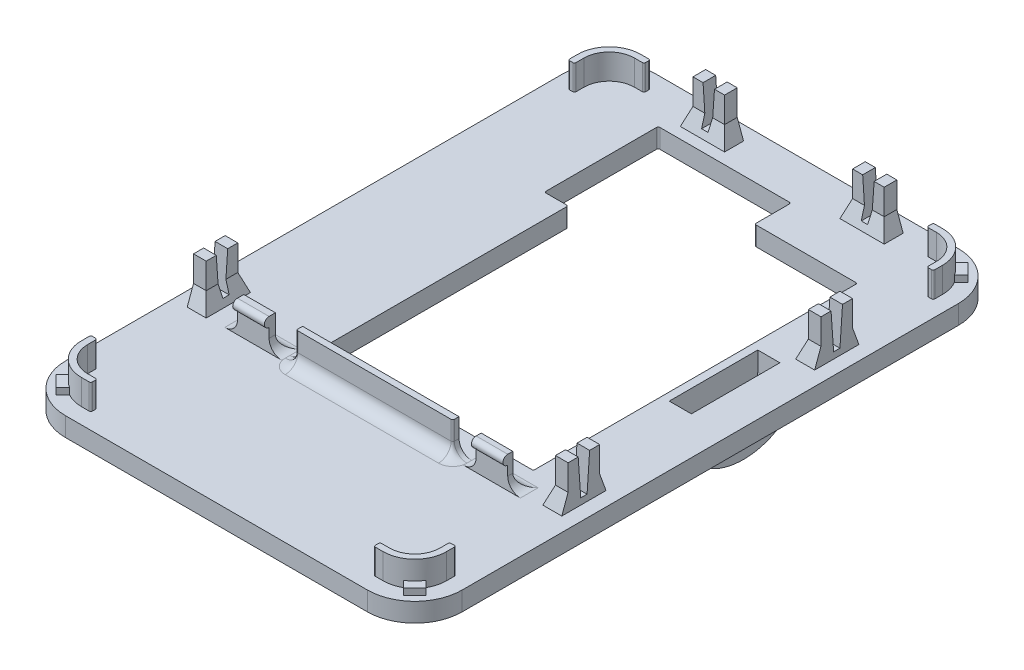
from build123d import *

# Parameters (mm, degrees)
BOSSAGE_BASE_DEPTH                 = 1.5
BOSSAGE_CORNER_DEPTH               = 4
CONGE_CORNER_R                     = 0.25
CONGE_CORNER_OF_SYM_TRIE1_CORNER_R = 0.25
SYM_TRIE2_CORNER_START             = 1
SYM_TRIE2_CORNER_DEPTH             = 4.5
ENL_V_OPENING_DEPTH                = 57.735818713
ENL_V_OPENING_DEPTH_BACK           = 57.735818713
ESQUISSE4_W                        = 3.5
ESQUISSE4_H                        = 14
BALAYAGE_BATTERIE_START            = 21.875
BALAYAGE_BATTERIE_DEPTH            = 3.5
BOSSAGE_BATTERIE_DEPTH             = 1.25
ESQUISSE8_W                        = 5
ESQUISSE8_H                        = 2
ESQUISSE8_W_2                      = 2
ESQUISSE8_H_2                      = 5
BOSSAGE_CLIP_DEPTH                 = 6.8
ENL_V_CLIP_RIGHT_REACH             = 78.907
ENL_V_CLIP_BACK_RIGHT_REACH        = 98.85
ENL_V_CLIP_BACK_LEFT_REACH         = 98.85
ENL_V_CLIP_LEFT1_REACH             = 99.397
ENL_V_CLIP_LEFT2_REACH             = 99.397
CHANFREIN_CLIP_SIZE                = 1
CHANFREIN_CLIP_SIZE_2              = 2.747477419
ESQUISSE15_W                       = 24.75
ESQUISSE15_H                       = 1
ESQUISSE15_W_2                     = 5
ESQUISSE15_H_2                     = 0.798793438
BOSSAGE_PALETTE_DEPTH              = 5
CONG_OPENING_R                     = 0.25
CONG_PALETTE_R                     = 2
BOSSAGE_SPACING_DEPTH              = 2.5
ESQUISSE17_R                       = 0.75
BOSS_EXTRU_1_DEPTH                 = 5
ESQUISSE18_R                       = 0.75
BOSS_EXTRU_2_DEPTH                 = 5


with BuildPart() as part:
    # Esquisse1 → Bossage_base (new, symmetric)
    with BuildSketch(Plane(origin=(0, 0, 0), x_dir=(1, 0, 0), z_dir=(0, 1, 0))):
        with BuildLine():
            Line((-23.875, -46.75), (23.875, -46.75))
            ThreePointArc((23.875, -46.75), (29.178300859, -44.553300859), (31.375, -39.25))
            Line((31.375, -39.25), (31.375, 39.25))
            ThreePointArc((31.375, 39.25), (29.178300859, 44.553300859), (23.875, 46.75))
            Line((23.875, 46.75), (-23.875, 46.75))
            ThreePointArc((-23.875, 46.75), (-29.178300859, 44.553300859), (-31.375, 39.25))
            Line((-31.375, 39.25), (-31.375, -39.25))
            ThreePointArc((-31.375, -39.25), (-29.178300859, -44.553300859), (-23.875, -46.75))
        make_face()
    extrude(amount=BOSSAGE_BASE_DEPTH, both=True)

    # Esquisse3 → Bossage_corner (add)
    with BuildSketch(Plane(origin=(0, 1.5, 0), x_dir=(1, 0, 0), z_dir=(0, 1, 0))):
        with BuildLine():
            Line((-23.875, 44.25), (-22.375, 44.25))
            Line((-22.375, 44.25), (-22.375, 43.25))
            Line((-22.375, 43.25), (-23.875, 43.25))
            ThreePointArc((-23.875, 43.25), (-26.703427125, 42.078427125), (-27.875, 39.25))
            Line((-27.875, 39.25), (-27.875, 37.75))
            Line((-27.875, 37.75), (-28.875, 37.75))
            Line((-28.875, 37.75), (-28.875, 39.25))
            ThreePointArc((-28.875, 39.25), (-27.410533906, 42.785533906), (-23.875, 44.25))
        make_face()
    bossage_corner = extrude(amount=BOSSAGE_CORNER_DEPTH)

    # Conge_corner
    conge_corner_edges = [part.edges().sort_by_distance(p)[0] for p in [
        (-22.375, 3.5, -43.25),
        (-22.375, 3.5, -44.25),
        (-28.875, 3.5, -37.75),
        (-27.875, 3.5, -37.75),
    ]]
    fillet(conge_corner_edges, radius=CONGE_CORNER_R)

    # Symétrie1_corner: Bossage_corner across plane
    add(bossage_corner.mirror(Plane(origin=(0, 0, 0), x_dir=(0, 0, 1), z_dir=(1, 0, 0))))

    # Conge_corner of Symétrie1_corner
    conge_corner_of_sym_trie1_corner_edges = [part.edges().sort_by_distance(p)[0] for p in [
        (22.375, 3.5, -43.25),
        (22.375, 3.5, -44.25),
        (28.875, 3.5, -37.75),
        (27.875, 3.5, -37.75),
    ]]
    fillet(conge_corner_of_sym_trie1_corner_edges, radius=CONGE_CORNER_OF_SYM_TRIE1_CORNER_R)

    # Symétrie2_corner: read off the stored shape, not the designer's step
    # Symétrie2_corner outline → Symétrie2_corner (add)
    with BuildSketch(Plane(origin=(0, 0, 0), x_dir=(1, 0, 0), z_dir=(0, 1, 0)).offset(SYM_TRIE2_CORNER_START)):
        with BuildLine():
            ThreePointArc((-22.625, -44.25), (-22.448223305, -44.176776695), (-22.375, -44))
            Line((-22.375, -44), (-22.375, -43.5))
            ThreePointArc((-22.375, -43.5), (-22.448223305, -43.323223305), (-22.625, -43.25))
            Line((-22.625, -43.25), (-23.875, -43.25))
            ThreePointArc((-23.875, -43.25), (-26.703427125, -42.078427125), (-27.875, -39.25))
            Line((-27.875, -39.25), (-27.875, -38))
            ThreePointArc((-27.875, -38), (-27.948223305, -37.823223305), (-28.125, -37.75))
            Line((-28.125, -37.75), (-28.625, -37.75))
            ThreePointArc((-28.625, -37.75), (-28.801776695, -37.823223305), (-28.875, -38))
            Line((-28.875, -38), (-28.875, -39.25))
            ThreePointArc((-28.875, -39.25), (-27.410533906, -42.785533906), (-23.875, -44.25))
            Line((-23.875, -44.25), (-22.625, -44.25))
        make_face()
        with BuildLine():
            Line((27.875, -38), (27.875, -39.25))
            ThreePointArc((27.875, -39.25), (26.703427125, -42.078427125), (23.875, -43.25))
            Line((23.875, -43.25), (22.625, -43.25))
            ThreePointArc((22.625, -43.25), (22.448223305, -43.323223305), (22.375, -43.5))
            Line((22.375, -43.5), (22.375, -44))
            ThreePointArc((22.375, -44), (22.448223305, -44.176776695), (22.625, -44.25))
            Line((22.625, -44.25), (23.875, -44.25))
            ThreePointArc((23.875, -44.25), (27.410533906, -42.785533906), (28.875, -39.25))
            Line((28.875, -39.25), (28.875, -38))
            ThreePointArc((28.875, -38), (28.801776695, -37.823223305), (28.625, -37.75))
            Line((28.625, -37.75), (28.125, -37.75))
            ThreePointArc((28.125, -37.75), (27.948223305, -37.823223305), (27.875, -38))
        make_face()
    extrude(amount=SYM_TRIE2_CORNER_DEPTH)

    # Esquisse4 → Enlèv_opening (cut, two sides: drawn at the far end of the back side and taken through both)
    with BuildSketch(Plane(origin=(0, -1.5, 0), x_dir=(-1, 0, 0), z_dir=(0, -1, 0)).offset(-ENL_V_OPENING_DEPTH_BACK)):
        Polygon((-20.625, 34), (-4.375, 34), (-4.375, 39.75), (16.625, 39.75), (16.625, 21.75), (12.875, 21.75), (12.875, -20.5), (-3.625, -20.5), (-3.625, -17.25), (-20.625, -17.25), align=None)
        with Locations((-23.625, 10)):
            Rectangle(ESQUISSE4_W, ESQUISSE4_H)
    extrude(amount=ENL_V_OPENING_DEPTH + ENL_V_OPENING_DEPTH_BACK, mode=Mode.SUBTRACT)

    # Balayage_batterie: read off the stored shape, not the designer's step
    # Balayage_batterie outline → Balayage_batterie (add)
    with BuildSketch(Plane.YZ.offset(BALAYAGE_BATTERIE_START)):
        with BuildLine():
            Line((-1.5, -3), (-1.5, -1.75))
            add(Edge.make_bspline(
                [(-1.5, -1.75), (-3.190722232, -1.750000002), (-4.786990528, -2.705218815), (-7.00497116, -5.780146506), (-7.625, -7.885757532), (-7.625, -12.114242468), (-7.00497116, -14.219853494), (-4.786990528, -17.294781185), (-3.190722232, -18.249999998), (-1.5, -18.25)],
                knots=[0, 0, 0, 0, 0.25, 0.25, 0.5, 0.5, 0.75, 0.75, 1, 1, 1, 1], degree=3))
            Line((-1.5, -18.25), (-1.5, -17))
            add(Edge.make_bspline(
                [(-1.5, -3), (-2.708159254, -3.000000002), (-3.954865391, -3.68832461), (-5.809522107, -6.259553243), (-6.375, -8.121805918), (-6.375, -11.878194082), (-5.809522107, -13.740446757), (-3.954865391, -16.31167539), (-2.708159254, -16.999999998), (-1.5, -17)],
                knots=[0, 0, 0, 0, 0.25, 0.25, 0.5, 0.5, 0.75, 0.75, 1, 1, 1, 1], degree=3))
        make_face()
    extrude(amount=BALAYAGE_BATTERIE_DEPTH)

    # Esquisse7 → Bossage_batterie (add)
    with BuildSketch(Plane(origin=(25.375, 0, 0), x_dir=(0, 0, -1), z_dir=(1, 0, 0))):
        with BuildLine():
            Line((1.75, -1.5), (18.25, -1.5))
            add(Edge.make_bspline(
                [(1.75, -1.5), (1.750000002, -3.190722232), (2.705218815, -4.786990528), (5.780146506, -7.00497116), (7.885757532, -7.625), (12.114242468, -7.625), (14.219853494, -7.00497116), (17.294781185, -4.786990528), (18.249999998, -3.190722232), (18.25, -1.5)],
                knots=[0, 0, 0, 0, 0.25, 0.25, 0.5, 0.5, 0.75, 0.75, 1, 1, 1, 1], degree=3))
        make_face()
    bossage_batterie = extrude(amount=BOSSAGE_BATTERIE_DEPTH)

    # Symétrie_batterie: Bossage_batterie across plane
    add(bossage_batterie.mirror(Plane.ZY.offset(-23.625)))

    # Esquisse8 → Bossage_clip (add)
    with BuildSketch(Plane(origin=(0, 1.5, 0), x_dir=(1, 0, 0), z_dir=(0, 1, 0))):
        with Locations((13.875, 43.5)):
            Rectangle(ESQUISSE8_W, ESQUISSE8_H)
        with Locations((-11.375, 43.5)):
            Rectangle(ESQUISSE8_W, ESQUISSE8_H)
        with Locations((-28.125, -18.75)):
            Rectangle(ESQUISSE8_W_2, ESQUISSE8_H_2)
        with Locations((28.125, 22.25)):
            Rectangle(ESQUISSE8_W_2, ESQUISSE8_H_2)
        with Locations((28.125, -17.75)):
            Rectangle(ESQUISSE8_W_2, ESQUISSE8_H_2)
    extrude(amount=BOSSAGE_CLIP_DEPTH)

    # Esquisse9 → Enlèv_clip_right (cut, up to next)
    with BuildSketch(Plane.ZY.offset(29.125), mode=Mode.PRIVATE) as enl_v_clip_right_sk1:
        Polygon((19.655575509, 8.3), (17.844424491, 8.3), (18.25, 2.5), (19.25, 2.5), align=None)
    enl_v_clip_right_tool1 = extrude(enl_v_clip_right_sk1.sketch, amount=-ENL_V_CLIP_RIGHT_REACH, mode=Mode.PRIVATE) & part.part
    add(enl_v_clip_right_tool1.solids().sort_by_distance((-29.125, 5.678929, 18.75))[0], mode=Mode.SUBTRACT)

    # Esquisse10 → Enlèv_clip_back_right (cut, up to next)
    with BuildSketch(Plane.XY.offset(-44.5), mode=Mode.PRIVATE) as enl_v_clip_back_right_sk1:
        Polygon((-10.469424491, 8.3), (-12.280575509, 8.3), (-11.875, 2.5), (-10.875, 2.5), align=None)
    enl_v_clip_back_right_tool1 = extrude(enl_v_clip_back_right_sk1.sketch, amount=ENL_V_CLIP_BACK_RIGHT_REACH, mode=Mode.PRIVATE) & part.part
    add(enl_v_clip_back_right_tool1.solids().sort_by_distance((-11.375, 5.678929, -44.5))[0], mode=Mode.SUBTRACT)

    # Esquisse11 → Enlèv_clip_back_left (cut, up to next)
    with BuildSketch(Plane.XY.offset(-44.5), mode=Mode.PRIVATE) as enl_v_clip_back_left_sk1:
        Polygon((14.780575509, 8.3), (12.969424491, 8.3), (13.375, 2.5), (14.375, 2.5), align=None)
    enl_v_clip_back_left_tool1 = extrude(enl_v_clip_back_left_sk1.sketch, amount=ENL_V_CLIP_BACK_LEFT_REACH, mode=Mode.PRIVATE) & part.part
    add(enl_v_clip_back_left_tool1.solids().sort_by_distance((13.875, 5.678929, -44.5))[0], mode=Mode.SUBTRACT)

    # Esquisse12 → Enlèv_clip_left1 (cut, up to next)
    with BuildSketch(Plane(origin=(29.125, 0, -29.125), x_dir=(0, 0, 1), z_dir=(-1, 0, 0)), mode=Mode.PRIVATE) as enl_v_clip_left1_sk1:
        Polygon((7.780575509, 8.3), (5.969424491, 8.3), (6.375, 2.5), (7.375, 2.5), align=None)
    enl_v_clip_left1_tool1 = extrude(enl_v_clip_left1_sk1.sketch, amount=ENL_V_CLIP_LEFT1_REACH, mode=Mode.PRIVATE) & part.part
    add(enl_v_clip_left1_tool1.solids().sort_by_distance((29.125, 5.678929, -22.25))[0], mode=Mode.SUBTRACT)

    # Esquisse13 → Enlèv_clip_left2 (cut, up to next)
    with BuildSketch(Plane(origin=(29.125, 0, -29.125), x_dir=(0, 0, 1), z_dir=(-1, 0, 0)), mode=Mode.PRIVATE) as enl_v_clip_left2_sk1:
        Polygon((47.780575509, 8.3), (45.969424491, 8.3), (46.375, 2.5), (47.375, 2.5), align=None)
    enl_v_clip_left2_tool1 = extrude(enl_v_clip_left2_sk1.sketch, amount=ENL_V_CLIP_LEFT2_REACH, mode=Mode.PRIVATE) & part.part
    add(enl_v_clip_left2_tool1.solids().sort_by_distance((29.125, 5.678929, 17.75))[0], mode=Mode.SUBTRACT)

    # Chanfrein_clip
    # the kernel refuses this chamfer: 2.747477419, 1 mm, written as the material it adds along each edge
    with BuildSketch(Plane(origin=(-19.997508551, 1.5, 21.25), x_dir=(0, 0, 1), z_dir=(-1, 0, 0))) as chanfrein_clip_piece_1_section:
        Polygon((CHANFREIN_CLIP_SIZE, 0), (0, CHANFREIN_CLIP_SIZE_2), (0, 0), align=None)
    chanfrein_clip_piece_1 = extrude(amount=9.127491449, mode=Mode.PRIVATE)
    chanfrein_clip_piece_1 = split(chanfrein_clip_piece_1, bisect_by=Plane(origin=(-25.408219663, -0.469337791, 21.25), z_dir=(-0.9396926207859094, -0.34202014332566605, 0)), keep=Keep.TOP, mode=Mode.PRIVATE)
    add(chanfrein_clip_piece_1)
    with BuildSketch(Plane(origin=(-27.125, 1.5, 9.122508551), x_dir=(1, 0, 0), z_dir=(0, 0, 1))) as chanfrein_clip_piece_2_section:
        Polygon((CHANFREIN_CLIP_SIZE, 0), (0, CHANFREIN_CLIP_SIZE_2), (0, 0), align=None)
    chanfrein_clip_piece_2 = extrude(amount=19.254982899, mode=Mode.PRIVATE)
    chanfrein_clip_piece_2 = split(chanfrein_clip_piece_2, bisect_by=Plane(origin=(-27.125, 2.5, 9.122508551), z_dir=(0, -1, 0)), keep=Keep.TOP, mode=Mode.PRIVATE)
    chanfrein_clip_piece_2 = split(chanfrein_clip_piece_2, bisect_by=Plane(origin=(-27.125, 5.719094425, 20.714375214), z_dir=(0, -0.34202014332566605, -0.9396926207859094)), keep=Keep.TOP, mode=Mode.PRIVATE)
    chanfrein_clip_piece_2 = split(chanfrein_clip_piece_2, bisect_by=Plane(origin=(-27.125, -0.469337791, 14.533219663), z_dir=(0, -0.34202014332566605, 0.9396926207859094)), keep=Keep.TOP, mode=Mode.PRIVATE)
    add(chanfrein_clip_piece_2)
    with BuildSketch(Plane(origin=(-27.125, 1.5, 9.122508551), x_dir=(1, 0, 0), z_dir=(0, 0, 1))) as chanfrein_clip_piece_3_section:
        Polygon((CHANFREIN_CLIP_SIZE, 0), (0, CHANFREIN_CLIP_SIZE_2), (0, 0), align=None)
    chanfrein_clip_piece_3 = extrude(amount=19.254982899, mode=Mode.PRIVATE)
    chanfrein_clip_piece_3 = split(chanfrein_clip_piece_3, bisect_by=Plane(origin=(-27.125, 2.14001661, 18.275172491), z_dir=(0, -0.06975647374412401, -0.9975640502598243)), keep=Keep.TOP, mode=Mode.PRIVATE)
    chanfrein_clip_piece_3 = split(chanfrein_clip_piece_3, bisect_by=Plane(origin=(-27.125, -0.469337791, 14.533219663), z_dir=(0, -0.34202014332566605, 0.9396926207859094)), keep=Keep.TOP, mode=Mode.PRIVATE)
    add(chanfrein_clip_piece_3)
    with BuildSketch(Plane(origin=(-27.125, 1.5, 9.122508551), x_dir=(1, 0, 0), z_dir=(0, 0, 1))) as chanfrein_clip_piece_4_section:
        Polygon((CHANFREIN_CLIP_SIZE, 0), (0, CHANFREIN_CLIP_SIZE_2), (0, 0), align=None)
    chanfrein_clip_piece_4 = extrude(amount=19.254982899, mode=Mode.PRIVATE)
    chanfrein_clip_piece_4 = split(chanfrein_clip_piece_4, bisect_by=Plane(origin=(-27.125, 0.800128771, 19.131133424), z_dir=(0, -0.0697564737441234, 0.9975640502598244)), keep=Keep.TOP, mode=Mode.PRIVATE)
    chanfrein_clip_piece_4 = split(chanfrein_clip_piece_4, bisect_by=Plane(origin=(-27.125, 5.719094425, 20.714375214), z_dir=(0, -0.34202014332566605, -0.9396926207859094)), keep=Keep.TOP, mode=Mode.PRIVATE)
    add(chanfrein_clip_piece_4)
    with BuildSketch(Plane(origin=(-29.125, 1.5, 16.25), x_dir=(0, 0, -1), z_dir=(1, 0, 0))) as chanfrein_clip_piece_5_section:
        Polygon((CHANFREIN_CLIP_SIZE, 0), (0, CHANFREIN_CLIP_SIZE_2), (0, 0), align=None)
    chanfrein_clip_piece_5 = extrude(amount=9.127491449, mode=Mode.PRIVATE)
    chanfrein_clip_piece_5 = split(chanfrein_clip_piece_5, bisect_by=Plane(origin=(-26.475933335, 2.464181415, 16.25), z_dir=(-0.9396926207859094, -0.34202014332566605, 0)), keep=Keep.TOP, mode=Mode.PRIVATE)
    add(chanfrein_clip_piece_5)
    with BuildSketch(Plane(origin=(-13.875, 1.5, -35.372508551), x_dir=(-1, 0, 0), z_dir=(0, 0, -1))) as chanfrein_clip_piece_6_section:
        Polygon((CHANFREIN_CLIP_SIZE, 0), (0, CHANFREIN_CLIP_SIZE_2), (0, 0), align=None)
    chanfrein_clip_piece_6 = extrude(amount=9.127491449, mode=Mode.PRIVATE)
    chanfrein_clip_piece_6 = split(chanfrein_clip_piece_6, bisect_by=Plane(origin=(-13.875, -0.469337791, -40.783219663), z_dir=(0, -0.34202014332566605, -0.9396926207859094)), keep=Keep.TOP, mode=Mode.PRIVATE)
    add(chanfrein_clip_piece_6)
    with BuildSketch(Plane(origin=(-1.747508551, 1.5, -42.5), x_dir=(0, 0, 1), z_dir=(-1, 0, 0))) as chanfrein_clip_piece_7_section:
        Polygon((CHANFREIN_CLIP_SIZE, 0), (0, CHANFREIN_CLIP_SIZE_2), (0, 0), align=None)
    chanfrein_clip_piece_7 = extrude(amount=19.254982899, mode=Mode.PRIVATE)
    chanfrein_clip_piece_7 = split(chanfrein_clip_piece_7, bisect_by=Plane(origin=(-1.747508551, 2.5, -42.5), z_dir=(0, -1, 0)), keep=Keep.TOP, mode=Mode.PRIVATE)
    chanfrein_clip_piece_7 = split(chanfrein_clip_piece_7, bisect_by=Plane(origin=(-13.339375214, 5.719094425, -42.5), z_dir=(0.9396926207859094, -0.34202014332566605, 1.6692294138669905e-15)), keep=Keep.TOP, mode=Mode.PRIVATE)
    chanfrein_clip_piece_7 = split(chanfrein_clip_piece_7, bisect_by=Plane(origin=(-7.158219663, -0.469337791, -42.5), z_dir=(-0.9396926207859094, -0.34202014332566605, 1.6692294138669905e-15)), keep=Keep.TOP, mode=Mode.PRIVATE)
    add(chanfrein_clip_piece_7)
    with BuildSketch(Plane(origin=(-1.747508551, 1.5, -42.5), x_dir=(0, 0, 1), z_dir=(-1, 0, 0))) as chanfrein_clip_piece_8_section:
        Polygon((CHANFREIN_CLIP_SIZE, 0), (0, CHANFREIN_CLIP_SIZE_2), (0, 0), align=None)
    chanfrein_clip_piece_8 = extrude(amount=19.254982899, mode=Mode.PRIVATE)
    chanfrein_clip_piece_8 = split(chanfrein_clip_piece_8, bisect_by=Plane(origin=(-10.900172491, 2.14001661, -42.5), z_dir=(0.9975640502598243, -0.06975647374412587, 0)), keep=Keep.TOP, mode=Mode.PRIVATE)
    chanfrein_clip_piece_8 = split(chanfrein_clip_piece_8, bisect_by=Plane(origin=(-7.158219663, -0.469337791, -42.5), z_dir=(-0.9396926207859094, -0.34202014332566605, 1.6692294138669905e-15)), keep=Keep.TOP, mode=Mode.PRIVATE)
    add(chanfrein_clip_piece_8)
    with BuildSketch(Plane(origin=(-1.747508551, 1.5, -42.5), x_dir=(0, 0, 1), z_dir=(-1, 0, 0))) as chanfrein_clip_piece_9_section:
        Polygon((CHANFREIN_CLIP_SIZE, 0), (0, CHANFREIN_CLIP_SIZE_2), (0, 0), align=None)
    chanfrein_clip_piece_9 = extrude(amount=19.254982899, mode=Mode.PRIVATE)
    chanfrein_clip_piece_9 = split(chanfrein_clip_piece_9, bisect_by=Plane(origin=(-11.756133424, 0.800128771, -42.5), z_dir=(-0.9975640502598243, -0.06975647374412587, 0)), keep=Keep.TOP, mode=Mode.PRIVATE)
    chanfrein_clip_piece_9 = split(chanfrein_clip_piece_9, bisect_by=Plane(origin=(-13.339375214, 5.719094425, -42.5), z_dir=(0.9396926207859094, -0.34202014332566605, 1.6692294138669905e-15)), keep=Keep.TOP, mode=Mode.PRIVATE)
    add(chanfrein_clip_piece_9)
    with BuildSketch(Plane(origin=(-8.875, 1.5, -44.5), x_dir=(1, 0, 0), z_dir=(0, 0, 1))) as chanfrein_clip_piece_10_section:
        Polygon((CHANFREIN_CLIP_SIZE, 0), (0, CHANFREIN_CLIP_SIZE_2), (0, 0), align=None)
    chanfrein_clip_piece_10 = extrude(amount=9.127491449, mode=Mode.PRIVATE)
    chanfrein_clip_piece_10 = split(chanfrein_clip_piece_10, bisect_by=Plane(origin=(-8.875, 2.464181415, -41.850933335), z_dir=(0, -0.34202014332566605, -0.9396926207859094)), keep=Keep.TOP, mode=Mode.PRIVATE)
    add(chanfrein_clip_piece_10)
    with BuildSketch(Plane(origin=(11.375, 1.5, -35.372508551), x_dir=(-1, 0, 0), z_dir=(0, 0, -1))) as chanfrein_clip_piece_11_section:
        Polygon((CHANFREIN_CLIP_SIZE, 0), (0, CHANFREIN_CLIP_SIZE_2), (0, 0), align=None)
    chanfrein_clip_piece_11 = extrude(amount=9.127491449, mode=Mode.PRIVATE)
    chanfrein_clip_piece_11 = split(chanfrein_clip_piece_11, bisect_by=Plane(origin=(11.375, -0.469337791, -40.783219663), z_dir=(0, -0.34202014332566605, -0.9396926207859094)), keep=Keep.TOP, mode=Mode.PRIVATE)
    add(chanfrein_clip_piece_11)
    with BuildSketch(Plane(origin=(23.502491449, 1.5, -42.5), x_dir=(0, 0, 1), z_dir=(-1, 0, 0))) as chanfrein_clip_piece_12_section:
        Polygon((CHANFREIN_CLIP_SIZE, 0), (0, CHANFREIN_CLIP_SIZE_2), (0, 0), align=None)
    chanfrein_clip_piece_12 = extrude(amount=19.254982899, mode=Mode.PRIVATE)
    chanfrein_clip_piece_12 = split(chanfrein_clip_piece_12, bisect_by=Plane(origin=(23.502491449, 2.5, -42.5), z_dir=(0, -1, 0)), keep=Keep.TOP, mode=Mode.PRIVATE)
    chanfrein_clip_piece_12 = split(chanfrein_clip_piece_12, bisect_by=Plane(origin=(11.910624786, 5.719094425, -42.5), z_dir=(0.9396926207859094, -0.34202014332566605, 0)), keep=Keep.TOP, mode=Mode.PRIVATE)
    chanfrein_clip_piece_12 = split(chanfrein_clip_piece_12, bisect_by=Plane(origin=(18.091780337, -0.469337791, -42.5), z_dir=(-0.939692620785909, -0.3420201433256671, -1.6692294138669895e-15)), keep=Keep.TOP, mode=Mode.PRIVATE)
    add(chanfrein_clip_piece_12)
    with BuildSketch(Plane(origin=(23.502491449, 1.5, -42.5), x_dir=(0, 0, 1), z_dir=(-1, 0, 0))) as chanfrein_clip_piece_13_section:
        Polygon((CHANFREIN_CLIP_SIZE, 0), (0, CHANFREIN_CLIP_SIZE_2), (0, 0), align=None)
    chanfrein_clip_piece_13 = extrude(amount=19.254982899, mode=Mode.PRIVATE)
    chanfrein_clip_piece_13 = split(chanfrein_clip_piece_13, bisect_by=Plane(origin=(14.349827509, 2.14001661, -42.5), z_dir=(0.9975640502598243, -0.06975647374412525, 0)), keep=Keep.TOP, mode=Mode.PRIVATE)
    chanfrein_clip_piece_13 = split(chanfrein_clip_piece_13, bisect_by=Plane(origin=(18.091780337, -0.469337791, -42.5), z_dir=(-0.939692620785909, -0.3420201433256671, -1.6692294138669895e-15)), keep=Keep.TOP, mode=Mode.PRIVATE)
    add(chanfrein_clip_piece_13)
    with BuildSketch(Plane(origin=(23.502491449, 1.5, -42.5), x_dir=(0, 0, 1), z_dir=(-1, 0, 0))) as chanfrein_clip_piece_14_section:
        Polygon((CHANFREIN_CLIP_SIZE, 0), (0, CHANFREIN_CLIP_SIZE_2), (0, 0), align=None)
    chanfrein_clip_piece_14 = extrude(amount=19.254982899, mode=Mode.PRIVATE)
    chanfrein_clip_piece_14 = split(chanfrein_clip_piece_14, bisect_by=Plane(origin=(13.493866576, 0.800128771, -42.5), z_dir=(-0.9975640502598243, -0.06975647374412555, 0)), keep=Keep.TOP, mode=Mode.PRIVATE)
    chanfrein_clip_piece_14 = split(chanfrein_clip_piece_14, bisect_by=Plane(origin=(11.910624786, 5.719094425, -42.5), z_dir=(0.9396926207859094, -0.34202014332566605, 0)), keep=Keep.TOP, mode=Mode.PRIVATE)
    add(chanfrein_clip_piece_14)
    with BuildSketch(Plane(origin=(16.375, 1.5, -44.5), x_dir=(1, 0, 0), z_dir=(0, 0, 1))) as chanfrein_clip_piece_15_section:
        Polygon((CHANFREIN_CLIP_SIZE, 0), (0, CHANFREIN_CLIP_SIZE_2), (0, 0), align=None)
    chanfrein_clip_piece_15 = extrude(amount=9.127491449, mode=Mode.PRIVATE)
    chanfrein_clip_piece_15 = split(chanfrein_clip_piece_15, bisect_by=Plane(origin=(16.375, 2.464181415, -41.850933335), z_dir=(0, -0.34202014332566605, -0.9396926207859094)), keep=Keep.TOP, mode=Mode.PRIVATE)
    add(chanfrein_clip_piece_15)
    with BuildSketch(Plane(origin=(29.125, 1.5, -24.75), x_dir=(0, 0, -1), z_dir=(-1, 0, 0))) as chanfrein_clip_piece_16_section:
        Polygon((CHANFREIN_CLIP_SIZE, 0), (0, -CHANFREIN_CLIP_SIZE_2), (0, 0), align=None)
    chanfrein_clip_piece_16 = extrude(amount=9.127491449, mode=Mode.PRIVATE)
    chanfrein_clip_piece_16 = split(chanfrein_clip_piece_16, bisect_by=Plane(origin=(26.475933335, 2.464181415, -24.75), z_dir=(0.9396926207859094, -0.34202014332566605, 0)), keep=Keep.TOP, mode=Mode.PRIVATE)
    add(chanfrein_clip_piece_16)
    with BuildSketch(Plane(origin=(27.125, 1.5, -31.877491449), x_dir=(-1, 0, 0), z_dir=(0, 0, 1))) as chanfrein_clip_piece_17_section:
        Polygon((CHANFREIN_CLIP_SIZE, 0), (0, -CHANFREIN_CLIP_SIZE_2), (0, 0), align=None)
    chanfrein_clip_piece_17 = extrude(amount=19.254982899, mode=Mode.PRIVATE)
    chanfrein_clip_piece_17 = split(chanfrein_clip_piece_17, bisect_by=Plane(origin=(27.125, 2.5, -31.877491449), z_dir=(0, -1, 0)), keep=Keep.TOP, mode=Mode.PRIVATE)
    chanfrein_clip_piece_17 = split(chanfrein_clip_piece_17, bisect_by=Plane(origin=(27.125, 5.719094425, -20.285624786), z_dir=(-1.6692294138669964e-15, -0.34202014332566605, -0.9396926207859094)), keep=Keep.TOP, mode=Mode.PRIVATE)
    chanfrein_clip_piece_17 = split(chanfrein_clip_piece_17, bisect_by=Plane(origin=(27.125, -0.469337791, -26.466780337), z_dir=(-1.6692294138669964e-15, -0.34202014332566605, 0.9396926207859094)), keep=Keep.TOP, mode=Mode.PRIVATE)
    add(chanfrein_clip_piece_17)
    with BuildSketch(Plane(origin=(27.125, 1.5, -31.877491449), x_dir=(-1, 0, 0), z_dir=(0, 0, 1))) as chanfrein_clip_piece_18_section:
        Polygon((CHANFREIN_CLIP_SIZE, 0), (0, -CHANFREIN_CLIP_SIZE_2), (0, 0), align=None)
    chanfrein_clip_piece_18 = extrude(amount=19.254982899, mode=Mode.PRIVATE)
    chanfrein_clip_piece_18 = split(chanfrein_clip_piece_18, bisect_by=Plane(origin=(27.125, 2.14001661, -22.724827509), z_dir=(0, -0.06975647374412568, -0.9975640502598243)), keep=Keep.TOP, mode=Mode.PRIVATE)
    chanfrein_clip_piece_18 = split(chanfrein_clip_piece_18, bisect_by=Plane(origin=(27.125, -0.469337791, -26.466780337), z_dir=(-1.6692294138669964e-15, -0.34202014332566605, 0.9396926207859094)), keep=Keep.TOP, mode=Mode.PRIVATE)
    add(chanfrein_clip_piece_18)
    with BuildSketch(Plane(origin=(27.125, 1.5, -31.877491449), x_dir=(-1, 0, 0), z_dir=(0, 0, 1))) as chanfrein_clip_piece_19_section:
        Polygon((CHANFREIN_CLIP_SIZE, 0), (0, -CHANFREIN_CLIP_SIZE_2), (0, 0), align=None)
    chanfrein_clip_piece_19 = extrude(amount=19.254982899, mode=Mode.PRIVATE)
    chanfrein_clip_piece_19 = split(chanfrein_clip_piece_19, bisect_by=Plane(origin=(27.125, 0.800128771, -21.868866576), z_dir=(0, -0.06975647374412583, 0.9975640502598243)), keep=Keep.TOP, mode=Mode.PRIVATE)
    chanfrein_clip_piece_19 = split(chanfrein_clip_piece_19, bisect_by=Plane(origin=(27.125, 5.719094425, -20.285624786), z_dir=(-1.6692294138669964e-15, -0.34202014332566605, -0.9396926207859094)), keep=Keep.TOP, mode=Mode.PRIVATE)
    add(chanfrein_clip_piece_19)
    with BuildSketch(Plane(origin=(19.997508551, 1.5, -19.75), x_dir=(0, 0, 1), z_dir=(1, 0, 0))) as chanfrein_clip_piece_20_section:
        Polygon((CHANFREIN_CLIP_SIZE, 0), (0, -CHANFREIN_CLIP_SIZE_2), (0, 0), align=None)
    chanfrein_clip_piece_20 = extrude(amount=9.127491449, mode=Mode.PRIVATE)
    chanfrein_clip_piece_20 = split(chanfrein_clip_piece_20, bisect_by=Plane(origin=(25.408219663, -0.469337791, -19.75), z_dir=(0.9396926207859094, -0.34202014332566605, 0)), keep=Keep.TOP, mode=Mode.PRIVATE)
    add(chanfrein_clip_piece_20)
    with BuildSketch(Plane(origin=(29.125, 1.5, 15.25), x_dir=(0, 0, -1), z_dir=(-1, 0, 0))) as chanfrein_clip_piece_21_section:
        Polygon((CHANFREIN_CLIP_SIZE, 0), (0, -CHANFREIN_CLIP_SIZE_2), (0, 0), align=None)
    chanfrein_clip_piece_21 = extrude(amount=9.127491449, mode=Mode.PRIVATE)
    chanfrein_clip_piece_21 = split(chanfrein_clip_piece_21, bisect_by=Plane(origin=(26.475933335, 2.464181415, 15.25), z_dir=(0.9396926207859094, -0.34202014332566605, 0)), keep=Keep.TOP, mode=Mode.PRIVATE)
    add(chanfrein_clip_piece_21)
    with BuildSketch(Plane(origin=(27.125, 1.5, 8.122508551), x_dir=(-1, 0, 0), z_dir=(0, 0, 1))) as chanfrein_clip_piece_22_section:
        Polygon((CHANFREIN_CLIP_SIZE, 0), (0, -CHANFREIN_CLIP_SIZE_2), (0, 0), align=None)
    chanfrein_clip_piece_22 = extrude(amount=19.254982899, mode=Mode.PRIVATE)
    chanfrein_clip_piece_22 = split(chanfrein_clip_piece_22, bisect_by=Plane(origin=(27.125, 2.5, 8.122508551), z_dir=(0, -1, 0)), keep=Keep.TOP, mode=Mode.PRIVATE)
    chanfrein_clip_piece_22 = split(chanfrein_clip_piece_22, bisect_by=Plane(origin=(27.125, -0.469337791, 13.533219663), z_dir=(0, -0.34202014332566605, 0.9396926207859094)), keep=Keep.TOP, mode=Mode.PRIVATE)
    chanfrein_clip_piece_22 = split(chanfrein_clip_piece_22, bisect_by=Plane(origin=(27.125, 5.719094425, 19.714375214), z_dir=(0, -0.34202014332566605, -0.9396926207859094)), keep=Keep.TOP, mode=Mode.PRIVATE)
    add(chanfrein_clip_piece_22)
    with BuildSketch(Plane(origin=(27.125, 1.5, 8.122508551), x_dir=(-1, 0, 0), z_dir=(0, 0, 1))) as chanfrein_clip_piece_23_section:
        Polygon((CHANFREIN_CLIP_SIZE, 0), (0, -CHANFREIN_CLIP_SIZE_2), (0, 0), align=None)
    chanfrein_clip_piece_23 = extrude(amount=19.254982899, mode=Mode.PRIVATE)
    chanfrein_clip_piece_23 = split(chanfrein_clip_piece_23, bisect_by=Plane(origin=(27.125, 2.14001661, 17.275172491), z_dir=(0, -0.06975647374412647, -0.9975640502598242)), keep=Keep.TOP, mode=Mode.PRIVATE)
    chanfrein_clip_piece_23 = split(chanfrein_clip_piece_23, bisect_by=Plane(origin=(27.125, -0.469337791, 13.533219663), z_dir=(0, -0.34202014332566605, 0.9396926207859094)), keep=Keep.TOP, mode=Mode.PRIVATE)
    add(chanfrein_clip_piece_23)
    with BuildSketch(Plane(origin=(27.125, 1.5, 8.122508551), x_dir=(-1, 0, 0), z_dir=(0, 0, 1))) as chanfrein_clip_piece_24_section:
        Polygon((CHANFREIN_CLIP_SIZE, 0), (0, -CHANFREIN_CLIP_SIZE_2), (0, 0), align=None)
    chanfrein_clip_piece_24 = extrude(amount=19.254982899, mode=Mode.PRIVATE)
    chanfrein_clip_piece_24 = split(chanfrein_clip_piece_24, bisect_by=Plane(origin=(27.125, 0.800128771, 18.131133424), z_dir=(0, -0.0697564737441265, 0.9975640502598242)), keep=Keep.TOP, mode=Mode.PRIVATE)
    chanfrein_clip_piece_24 = split(chanfrein_clip_piece_24, bisect_by=Plane(origin=(27.125, 5.719094425, 19.714375214), z_dir=(0, -0.34202014332566605, -0.9396926207859094)), keep=Keep.TOP, mode=Mode.PRIVATE)
    add(chanfrein_clip_piece_24)
    with BuildSketch(Plane(origin=(19.997508551, 1.5, 20.25), x_dir=(0, 0, 1), z_dir=(1, 0, 0))) as chanfrein_clip_piece_25_section:
        Polygon((CHANFREIN_CLIP_SIZE, 0), (0, -CHANFREIN_CLIP_SIZE_2), (0, 0), align=None)
    chanfrein_clip_piece_25 = extrude(amount=9.127491449, mode=Mode.PRIVATE)
    chanfrein_clip_piece_25 = split(chanfrein_clip_piece_25, bisect_by=Plane(origin=(25.408219663, -0.469337791, 20.25), z_dir=(0.9396926207859094, -0.34202014332566605, 0)), keep=Keep.TOP, mode=Mode.PRIVATE)
    add(chanfrein_clip_piece_25)

    # Esquisse15 → Bossage_palette (add)
    with BuildSketch(Plane(origin=(0, 1.5, 0), x_dir=(1, 0, 0), z_dir=(0, 1, 0))):
        with Locations((0, -21.25)):
            Rectangle(ESQUISSE15_W, ESQUISSE15_H)
        with Locations((18.875, -21.650603281)):
            Rectangle(ESQUISSE15_W_2, ESQUISSE15_H_2)
        with Locations((-18.875, -21.55)):
            Rectangle(ESQUISSE15_W_2, ESQUISSE15_H)
    extrude(amount=BOSSAGE_PALETTE_DEPTH)

    # Congé_opening
    cong_opening_edges = [part.edges().sort_by_distance(p)[0] for p in [
        (20.625, 0, 17.25),
        (20.625, 0, -34),
        (4.375, 0, -34),
        (4.375, 0, -39.75),
        (-16.625, 0, -39.75),
        (-16.625, 0, -21.75),
        (-12.875, 0, -21.75),
        (-12.875, 0, 20.5),
        (3.625, 0, 20.5),
        (3.625, 0, 17.25),
        (-12.375, 4, 21.75),
        (12.375, 4, 21.75),
    ]]
    fillet(cong_opening_edges, radius=CONG_OPENING_R)

    # Congé_palette
    cong_palette_edges = [part.edges().sort_by_distance(p)[0] for p in [
        (-12.375, 1.5, 21.125),
        (16.375, 1.5, 21.650603281),
        (21.375, 1.5, 21.650603281),
        (18.875, 1.5, 21.251206562),
        (-16.375, 1.5, 21.55),
        (-18.875, 1.5, 21.05),
        (-21.375, 1.5, 21.55),
        (12.375, 1.5, 21.125),
        (0, 1.5, 21.75),
        (12.301776695, 1.5, 21.676776695),
        (-12.301776695, 1.5, 21.676776695),
    ]]
    fillet(cong_palette_edges, radius=CONG_PALETTE_R - 0.0001)  # a hair under: the kernel refuses the full size

    # Esquisse16 → Bossage_spacing (add)
    with BuildSketch(Plane(origin=(0, 0, 0), x_dir=(1, 0, 0), z_dir=(0, 1, 0))):
        Polygon((-28.182149461, 41.789382508), (-26.414382508, 43.557149461), (-27.47504268, 44.617809633), (-29.242809633, 42.85004268), align=None)
        Polygon((28.182149461, 41.789382508), (26.414382508, 43.557149461), (27.47504268, 44.617809633), (29.242809633, 42.85004268), align=None)
        Polygon((29.242809633, -42.85004268), (28.182149461, -41.789382508), (26.414382508, -43.557149461), (27.47504268, -44.617809633), align=None)
        Polygon((-28.182149461, -41.789382508), (-26.414382508, -43.557149461), (-27.47504268, -44.617809633), (-29.242809633, -42.85004268), align=None)
    extrude(amount=BOSSAGE_SPACING_DEPTH)

    # Esquisse17 → Boss.-Extru.1 (add)
    with BuildSketch(Plane.ZY.offset(21.375)):
        with Locations((22.05, 5.75)):
            Circle(ESQUISSE17_R)
    extrude(amount=-BOSS_EXTRU_1_DEPTH)

    # Esquisse18 → Boss.-Extru.2 (add)
    with BuildSketch(Plane.ZY.offset(-16.375)):
        with Locations((22.05, 5.75)):
            Circle(ESQUISSE18_R)
    extrude(amount=-BOSS_EXTRU_2_DEPTH)


solid = part.part
